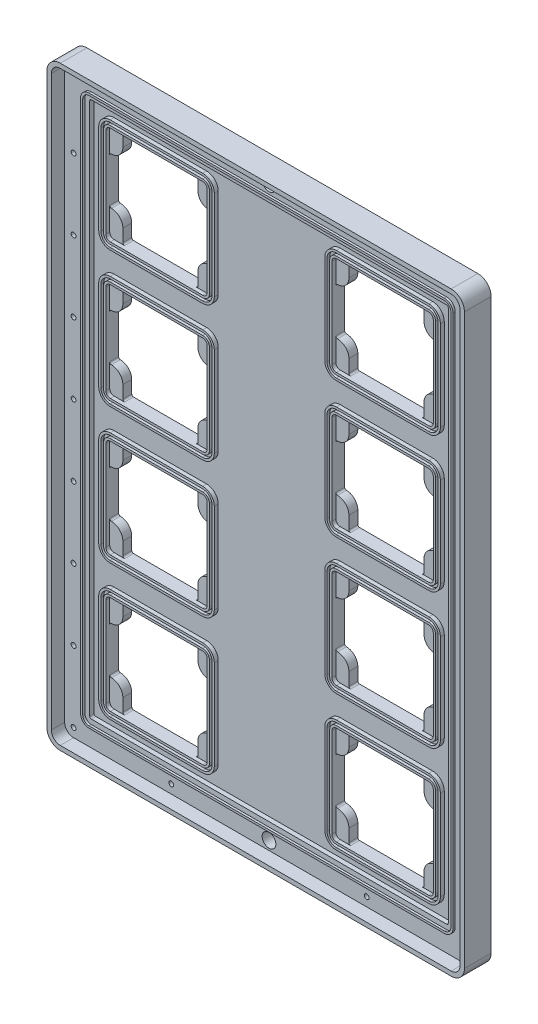
from build123d import *

# Parameters (mm, degrees)
SKETCH1_W            = 292.1
SKETCH1_H            = 419.1
BOSS_EXTRUDE1_DEPTH  = 9.525
SKETCH4_R            = 1.7272
CUT_EXTRUDE1_DEPTH   = 6.985
LPATTERN2_COUNT      = 8
LPATTERN2_PITCH      = 50.8
LPATTERN3_COUNT      = 4
LPATTERN3_PITCH      = 69.85
CUT_EXTRUDE3_DEPTH   = 3.175
BOSS_EXTRUDE2_DEPTH  = 1.5875
SKETCH7_R            = 4.9022
CUT_EXTRUDE4_DEPTH   = 511.938299235
FILLET1_R            = 6.35
CUT_EXTRUDE5_DEPTH   = 3.175
CUT_EXTRUDE6_DEPTH   = 511.970358882
SKETCH11_R           = 1.1303
CUT_EXTRUDE7_DEPTH   = 3.96875
BOSS_EXTRUDE3_DEPTH  = 2.794
BOSS_EXTRUDE4_DEPTH  = 0.79375
LPATTERN1_COUNT      = 2
LPATTERN1_PITCH      = 161.5948
LPATTERN1_COUNT_DIR2 = 4
LPATTERN1_PITCH_DIR2 = 96.8756
BOSS_EXTRUDE5_START  = -19.05
BOSS_EXTRUDE5_DEPTH  = 19.05


with BuildPart() as part:
    # Sketch1 → Boss-Extrude1 (new body)
    with BuildSketch(Plane.XY):
        with Locations((146.05, 209.55)):
            Rectangle(SKETCH1_W, SKETCH1_H)
    extrude(amount=BOSS_EXTRUDE1_DEPTH)

    # Sketch4 → Cut-Extrude1 (cut)
    with BuildSketch(Plane.XY.offset(9.525)):
        with Locations((6.35, 6.35)):
            Circle(SKETCH4_R)
        with Locations((6.35, 412.75)):
            Circle(SKETCH4_R)
        with Locations((285.75, 412.75)):
            Circle(SKETCH4_R)
        with Locations((285.75, 6.35)):
            Circle(SKETCH4_R)
    cut_extrude1 = extrude(amount=-CUT_EXTRUDE1_DEPTH, mode=Mode.SUBTRACT)

    # LPattern2: Cut-Extrude1 ×8
    with Locations(*[(0, -i * LPATTERN2_PITCH, 0) for i in range(1, LPATTERN2_COUNT)]):
        add(cut_extrude1, mode=Mode.SUBTRACT)

    # LPattern3: Cut-Extrude1 ×4
    with Locations(*[(-i * LPATTERN3_PITCH, 0, 0) for i in range(1, LPATTERN3_COUNT)]):
        add(cut_extrude1, mode=Mode.SUBTRACT)

    # Sketch6 → Cut-Extrude3 (cut)
    with BuildSketch(Plane.XY.offset(9.525)):
        with BuildLine():
            Line((273.05, 401.193), (19.05, 401.193))
            ThreePointArc((19.05, 401.193), (18.241776949, 400.858223051), (17.907, 400.05))
            Line((17.907, 400.05), (17.907, 19.05))
            ThreePointArc((17.907, 19.05), (18.241776949, 18.241776949), (19.05, 17.907))
            Line((19.05, 17.907), (273.05, 17.907))
            ThreePointArc((273.05, 17.907), (273.858223051, 18.241776949), (274.193, 19.05))
            Line((274.193, 19.05), (274.193, 400.05))
            ThreePointArc((274.193, 400.05), (273.858223051, 400.858223051), (273.05, 401.193))
        make_face()
    extrude(amount=-CUT_EXTRUDE3_DEPTH, mode=Mode.SUBTRACT)

    # Sketch5 → Boss-Extrude2 (add)
    with BuildSketch(Plane.XY.offset(9.525)):
        with BuildLine():
            ThreePointArc((19.05, 406.146), (14.739477062, 404.360522938), (12.954, 400.05))
            Line((12.954, 400.05), (12.954, 19.05))
            ThreePointArc((12.954, 19.05), (14.739477062, 14.739477062), (19.05, 12.954))
            Line((19.05, 12.954), (273.05, 12.954))
            ThreePointArc((273.05, 12.954), (277.360522938, 14.739477062), (279.146, 19.05))
            Line((279.146, 19.05), (279.146, 400.05))
            ThreePointArc((279.146, 400.05), (277.360522938, 404.360522938), (273.05, 406.146))
            Line((273.05, 406.146), (19.05, 406.146))
        make_face()
        with BuildLine():
            ThreePointArc((273.05, 404.622), (276.282892204, 403.282892204), (277.622, 400.05))
            Line((277.622, 400.05), (277.622, 19.05))
            ThreePointArc((277.622, 19.05), (276.282892204, 15.817107796), (273.05, 14.478))
            Line((273.05, 14.478), (19.05, 14.478))
            ThreePointArc((19.05, 14.478), (15.817107796, 15.817107796), (14.478, 19.05))
            Line((14.478, 19.05), (14.478, 400.05))
            ThreePointArc((14.478, 400.05), (15.817107796, 403.282892204), (19.05, 404.622))
            Line((19.05, 404.622), (273.05, 404.622))
        make_face(mode=Mode.SUBTRACT)
    extrude(amount=BOSS_EXTRUDE2_DEPTH)

    # Sketch7 → Cut-Extrude4 (cut, through all)
    with BuildSketch(Plane.XY.offset(9.525)):
        with Locations((146.05, 6.35)):
            Circle(SKETCH7_R)
        with Locations((146.05, 412.75)):
            Circle(SKETCH7_R)
    extrude(amount=-CUT_EXTRUDE4_DEPTH, mode=Mode.SUBTRACT)

    # Fillet1
    fillet1_edges = [part.edges().sort_by_distance(p)[0] for p in [
        (0, 419.1, 4.7625),
        (292.1, 419.1, 4.7625),
        (0, 0, 4.7625),
        (292.1, 0, 4.7625),
    ]]
    fillet(fillet1_edges, radius=FILLET1_R)

    # Sketch8 → Cut-Extrude5 (cut)
    with BuildSketch(Plane(origin=(0, 0, 0), x_dir=(-1, 0, 0), z_dir=(0, 0, -1))):
        with BuildLine():
            Line((-201.2442, 393.7), (-252.4506, 393.7))
            ThreePointArc((-252.4506, 393.7), (-255.881057838, 392.279057838), (-257.302, 388.8486))
            Line((-257.302, 388.8486), (-257.302, 379.857))
            ThreePointArc((-257.302, 379.857), (-258.633668309, 376.642068309), (-261.8486, 375.3104))
            ThreePointArc((-261.8486, 375.3104), (-265.279057838, 373.889457838), (-266.7, 370.459))
            Line((-266.7, 370.459), (-266.7, 339.2678))
            ThreePointArc((-266.7, 339.2678), (-265.279057838, 335.837342162), (-261.8486, 334.4164))
            ThreePointArc((-261.8486, 334.4164), (-258.633668309, 333.084731691), (-257.302, 329.8698))
            Line((-257.302, 329.8698), (-257.302, 320.8782))
            ThreePointArc((-257.302, 320.8782), (-255.881057838, 317.447742162), (-252.4506, 316.0268))
            Line((-252.4506, 316.0268), (-201.2442, 316.0268))
            ThreePointArc((-201.2442, 316.0268), (-197.813742162, 317.447742162), (-196.3928, 320.8782))
            Line((-196.3928, 320.8782), (-196.3928, 329.8698))
            ThreePointArc((-196.3928, 329.8698), (-195.061131691, 333.084731691), (-191.8462, 334.4164))
            ThreePointArc((-191.8462, 334.4164), (-188.415742162, 335.837342162), (-186.9948, 339.2678))
            Line((-186.9948, 339.2678), (-186.9948, 370.459))
            ThreePointArc((-186.9948, 370.459), (-188.415742162, 373.889457838), (-191.8462, 375.3104))
            ThreePointArc((-191.8462, 375.3104), (-195.061131691, 376.642068309), (-196.3928, 379.857))
            Line((-196.3928, 379.857), (-196.3928, 388.8486))
            ThreePointArc((-196.3928, 388.8486), (-197.813742162, 392.279057838), (-201.2442, 393.7))
        make_face()
        with BuildLine():
            Line((-264.668, 370.459), (-264.668, 339.2678))
            ThreePointArc((-264.668, 339.2678), (-263.842216859, 337.274183141), (-261.8486, 336.4484))
            ThreePointArc((-261.8486, 336.4484), (-257.196827329, 334.521572671), (-255.27, 329.8698))
            Line((-255.27, 329.8698), (-255.27, 320.8782))
            ThreePointArc((-255.27, 320.8782), (-254.444216859, 318.884583141), (-252.4506, 318.0588))
            Line((-252.4506, 318.0588), (-201.2442, 318.0588))
            ThreePointArc((-201.2442, 318.0588), (-199.250583141, 318.884583141), (-198.4248, 320.8782))
            Line((-198.4248, 320.8782), (-198.4248, 329.8698))
            ThreePointArc((-198.4248, 329.8698), (-196.497972671, 334.521572671), (-191.8462, 336.4484))
            ThreePointArc((-191.8462, 336.4484), (-189.852583141, 337.274183141), (-189.0268, 339.2678))
            Line((-189.0268, 339.2678), (-189.0268, 370.459))
            ThreePointArc((-189.0268, 370.459), (-189.852583141, 372.452616859), (-191.8462, 373.2784))
            ThreePointArc((-191.8462, 373.2784), (-196.497972671, 375.205227329), (-198.4248, 379.857))
            Line((-198.4248, 379.857), (-198.4248, 388.8486))
            ThreePointArc((-198.4248, 388.8486), (-199.250583141, 390.842216859), (-201.2442, 391.668))
            Line((-201.2442, 391.668), (-252.4506, 391.668))
            ThreePointArc((-252.4506, 391.668), (-254.444216859, 390.842216859), (-255.27, 388.8486))
            Line((-255.27, 388.8486), (-255.27, 379.857))
            ThreePointArc((-255.27, 379.857), (-257.196827329, 375.205227329), (-261.8486, 373.2784))
            ThreePointArc((-261.8486, 373.2784), (-263.842216859, 372.452616859), (-264.668, 370.459))
        make_face(mode=Mode.SUBTRACT)
    cut_extrude5 = extrude(amount=-CUT_EXTRUDE5_DEPTH, mode=Mode.SUBTRACT)

    # Sketch10 → Cut-Extrude6 (cut, through all)
    with BuildSketch(Plane(origin=(0, 0, 0), x_dir=(-1, 0, 0), z_dir=(0, 0, -1))):
        with BuildLine():
            Line((-263.0805, 370.459), (-263.0805, 339.2678))
            ThreePointArc((-263.0805, 339.2678), (-262.719684844, 338.396715156), (-261.8486, 338.0359))
            ThreePointArc((-261.8486, 338.0359), (-256.074295314, 335.644104686), (-253.6825, 329.8698))
            Line((-253.6825, 329.8698), (-253.6825, 320.8782))
            ThreePointArc((-253.6825, 320.8782), (-253.321684844, 320.007115156), (-252.4506, 319.6463))
            Line((-252.4506, 319.6463), (-201.2442, 319.6463))
            ThreePointArc((-201.2442, 319.6463), (-200.373115156, 320.007115156), (-200.0123, 320.8782))
            Line((-200.0123, 320.8782), (-200.0123, 329.8698))
            ThreePointArc((-200.0123, 329.8698), (-197.620504686, 335.644104686), (-191.8462, 338.0359))
            ThreePointArc((-191.8462, 338.0359), (-190.975115156, 338.396715156), (-190.6143, 339.2678))
            Line((-190.6143, 339.2678), (-190.6143, 370.459))
            ThreePointArc((-190.6143, 370.459), (-190.975115156, 371.330084844), (-191.8462, 371.6909))
            ThreePointArc((-191.8462, 371.6909), (-197.620504686, 374.082695314), (-200.0123, 379.857))
            Line((-200.0123, 379.857), (-200.0123, 388.8486))
            ThreePointArc((-200.0123, 388.8486), (-200.373115156, 389.719684844), (-201.2442, 390.0805))
            Line((-201.2442, 390.0805), (-252.4506, 390.0805))
            ThreePointArc((-252.4506, 390.0805), (-253.321684844, 389.719684844), (-253.6825, 388.8486))
            Line((-253.6825, 388.8486), (-253.6825, 379.857))
            ThreePointArc((-253.6825, 379.857), (-256.074295314, 374.082695314), (-261.8486, 371.6909))
            ThreePointArc((-261.8486, 371.6909), (-262.719684844, 371.330084844), (-263.0805, 370.459))
        make_face()
    cut_extrude6 = extrude(amount=-CUT_EXTRUDE6_DEPTH, mode=Mode.SUBTRACT)

    # Sketch11 → Cut-Extrude7 (cut)
    with BuildSketch(Plane(origin=(0, 0, 0), x_dir=(-1, 0, 0), z_dir=(0, 0, -1))):
        with Locations((-261.8486, 388.8994)):
            Circle(SKETCH11_R)
        with Locations((-191.8462, 388.8994)):
            Circle(SKETCH11_R)
        with Locations((-191.8462, 320.8274)):
            Circle(SKETCH11_R)
        with Locations((-261.8486, 320.8274)):
            Circle(SKETCH11_R)
    cut_extrude7 = extrude(amount=-CUT_EXTRUDE7_DEPTH, mode=Mode.SUBTRACT)

    # Sketch12 → Boss-Extrude3 (add)
    # profile 1 of 2: a face of its own
    with BuildSketch(Plane.XY.offset(6.35)):
        with BuildLine():
            ThreePointArc((193.7893, 395.1605), (187.952133521, 392.742666479), (185.5343, 386.9055))
            Line((185.5343, 386.9055), (185.5343, 322.8213))
            ThreePointArc((185.5343, 322.8213), (187.952133521, 316.984133521), (193.7893, 314.5663))
            Line((193.7893, 314.5663), (259.9055, 314.5663))
            ThreePointArc((259.9055, 314.5663), (265.742666479, 316.984133521), (268.1605, 322.8213))
            Line((268.1605, 322.8213), (268.1605, 386.9055))
            ThreePointArc((268.1605, 386.9055), (265.742666479, 392.742666479), (259.9055, 395.1605))
            Line((259.9055, 395.1605), (193.7893, 395.1605))
        make_face()
        with BuildLine():
            Line((187.1218, 322.8213), (187.1218, 386.9055))
            ThreePointArc((187.1218, 386.9055), (189.074665536, 391.620134464), (193.7893, 393.573))
            Line((193.7893, 393.573), (259.9055, 393.573))
            ThreePointArc((259.9055, 393.573), (264.620134464, 391.620134464), (266.573, 386.9055))
            Line((266.573, 386.9055), (266.573, 322.8213))
            ThreePointArc((266.573, 322.8213), (264.620134464, 318.106665536), (259.9055, 316.1538))
            Line((259.9055, 316.1538), (193.7893, 316.1538))
            ThreePointArc((193.7893, 316.1538), (189.074665536, 318.106665536), (187.1218, 322.8213))
        make_face(mode=Mode.SUBTRACT)
    # profile 2 of 2: a face of its own
    with BuildSketch(Plane.XY.offset(6.35)):
        with BuildLine():
            Line((259.9055, 391.668), (193.7893, 391.668))
            ThreePointArc((193.7893, 391.668), (190.421703955, 390.273096045), (189.0268, 386.9055))
            Line((189.0268, 386.9055), (189.0268, 322.8213))
            ThreePointArc((189.0268, 322.8213), (190.421703955, 319.453703955), (193.7893, 318.0588))
            Line((193.7893, 318.0588), (259.9055, 318.0588))
            ThreePointArc((259.9055, 318.0588), (263.273096045, 319.453703955), (264.668, 322.8213))
            Line((264.668, 322.8213), (264.668, 386.9055))
            ThreePointArc((264.668, 386.9055), (263.273096045, 390.273096045), (259.9055, 391.668))
        make_face()
        with BuildLine():
            ThreePointArc((190.6143, 386.9055), (191.54423597, 389.15056403), (193.7893, 390.0805))
            Line((193.7893, 390.0805), (259.9055, 390.0805))
            ThreePointArc((259.9055, 390.0805), (262.15056403, 389.15056403), (263.0805, 386.9055))
            Line((263.0805, 386.9055), (263.0805, 322.8213))
            ThreePointArc((263.0805, 322.8213), (262.15056403, 320.57623597), (259.9055, 319.6463))
            Line((259.9055, 319.6463), (193.7893, 319.6463))
            ThreePointArc((193.7893, 319.6463), (191.54423597, 320.57623597), (190.6143, 322.8213))
            Line((190.6143, 322.8213), (190.6143, 386.9055))
        make_face(mode=Mode.SUBTRACT)
    boss_extrude3 = extrude(amount=BOSS_EXTRUDE3_DEPTH)

    # Sketch12<3> → Boss-Extrude4 (add)
    with BuildSketch(Plane.XY.offset(6.35)):
        with BuildLine():
            ThreePointArc((193.7893, 393.573), (189.074665536, 391.620134464), (187.1218, 386.9055))
            Line((187.1218, 386.9055), (187.1218, 322.8213))
            ThreePointArc((187.1218, 322.8213), (189.074665536, 318.106665536), (193.7893, 316.1538))
            Line((193.7893, 316.1538), (259.9055, 316.1538))
            ThreePointArc((259.9055, 316.1538), (264.620134464, 318.106665536), (266.573, 322.8213))
            Line((266.573, 322.8213), (266.573, 386.9055))
            ThreePointArc((266.573, 386.9055), (264.620134464, 391.620134464), (259.9055, 393.573))
            Line((259.9055, 393.573), (193.7893, 393.573))
        make_face()
        with BuildLine():
            ThreePointArc((189.0268, 386.9055), (190.421703955, 390.273096045), (193.7893, 391.668))
            Line((193.7893, 391.668), (259.9055, 391.668))
            ThreePointArc((259.9055, 391.668), (263.273096045, 390.273096045), (264.668, 386.9055))
            Line((264.668, 386.9055), (264.668, 322.8213))
            ThreePointArc((264.668, 322.8213), (263.273096045, 319.453703955), (259.9055, 318.0588))
            Line((259.9055, 318.0588), (193.7893, 318.0588))
            ThreePointArc((193.7893, 318.0588), (190.421703955, 319.453703955), (189.0268, 322.8213))
            Line((189.0268, 322.8213), (189.0268, 386.9055))
        make_face(mode=Mode.SUBTRACT)
    boss_extrude4 = extrude(amount=BOSS_EXTRUDE4_DEPTH)

    # LPattern1: Cut-Extrude5, Cut-Extrude6, Cut-Extrude7, Boss-Extrude3, Boss-Extrude4 2 × 4
    with Locations(*[(-i * LPATTERN1_PITCH, -j * LPATTERN1_PITCH_DIR2, 0) for i in range(LPATTERN1_COUNT) for j in range(LPATTERN1_COUNT_DIR2) if (i, j) != (0, 0)]):
        add(cut_extrude5, mode=Mode.SUBTRACT)
        add(cut_extrude6, mode=Mode.SUBTRACT)
        add(cut_extrude7, mode=Mode.SUBTRACT)
        add(boss_extrude3)
        add(boss_extrude4)

    # Sketch13 → Boss-Extrude5 (add)
    with BuildSketch(Plane(origin=(0, 0, 0), x_dir=(-1, 0, 0), z_dir=(0, 0, -1)).offset(BOSS_EXTRUDE5_START)):
        with BuildLine():
            Line((-285.75, -3.175), (-6.35, -3.175))
            ThreePointArc((-6.35, -3.175), (0.385192091, -0.385192091), (3.175, 6.35))
            Line((3.175, 6.35), (3.175, 412.75))
            ThreePointArc((3.175, 412.75), (0.385192091, 419.485192091), (-6.35, 422.275))
            Line((-6.35, 422.275), (-285.75, 422.275))
            ThreePointArc((-285.75, 422.275), (-292.485192091, 419.485192091), (-295.275, 412.75))
            Line((-295.275, 412.75), (-295.275, 6.35))
            ThreePointArc((-295.275, 6.35), (-292.485192091, -0.385192091), (-285.75, -3.175))
        make_face()
        with BuildLine():
            Line((-6.35, 419.1), (-285.75, 419.1))
            ThreePointArc((-285.75, 419.1), (-290.240128061, 417.240128061), (-292.1, 412.75))
            Line((-292.1, 412.75), (-292.1, 6.35))
            ThreePointArc((-292.1, 6.35), (-290.240128061, 1.859871939), (-285.75, 0))
            Line((-285.75, 0), (-6.35, 0))
            ThreePointArc((-6.35, 0), (-1.859871939, 1.859871939), (0, 6.35))
            Line((0, 6.35), (0, 412.75))
            ThreePointArc((0, 412.75), (-1.859871939, 417.240128061), (-6.35, 419.1))
        make_face(mode=Mode.SUBTRACT)
    extrude(amount=BOSS_EXTRUDE5_DEPTH)


solid = part.part
